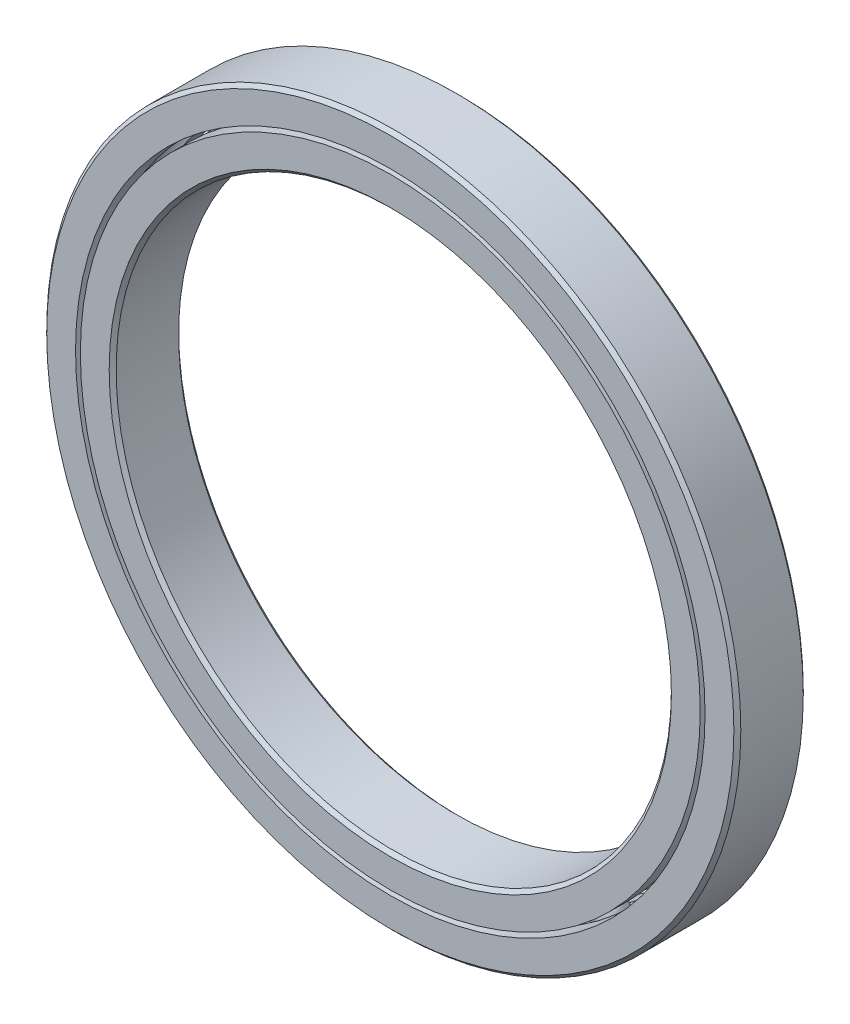
from build123d import *

# Parameters (mm, degrees)
CIRPATTERN1_COUNT = 10


with BuildPart() as part:
    # Sketch1 → Revolve1 (revolve)
    with BuildSketch(Plane(origin=(0, 0, 0), x_dir=(0, 0, -1), z_dir=(1, 0, 0))):
        with BuildLine():
            Line((2.8575, 31.75), (-2.8575, 31.75))
            Line((-2.8575, 31.75), (-3.175, 31.4325))
            Line((-3.175, 31.4325), (-3.175, 28.794807692))
            Line((-3.175, 28.794807692), (-1.411111111, 28.794807692))
            ThreePointArc((-1.411111111, 28.794807692), (0, 30.003128142), (1.411111111, 28.794807692))
            Line((1.411111111, 28.794807692), (3.175, 28.794807692))
            Line((3.175, 28.794807692), (3.175, 31.4325))
            Line((3.175, 31.4325), (2.8575, 31.75))
        make_face()
    revolve(axis=Axis((0, 0, 3.175), (0, 0, -1)))


with BuildPart() as body_2:
    # Sketch3 → Revolve3 (revolve)
    with BuildSketch(Plane(origin=(0, 0, 0), x_dir=(0, 0, -1), z_dir=(1, 0, 0))):
        with BuildLine():
            Line((-3.175, 28.355192308), (-1.411111111, 28.355192308))
            ThreePointArc((-1.411111111, 28.355192308), (0, 27.146871858), (1.411111111, 28.355192308))
            Line((1.411111111, 28.355192308), (3.175, 28.355192308))
            Line((3.175, 28.355192308), (3.175, 25.7175))
            Line((3.175, 25.7175), (2.8575, 25.4))
            Line((2.8575, 25.4), (-2.8575, 25.4))
            Line((-2.8575, 25.4), (-3.175, 25.7175))
            Line((-3.175, 25.7175), (-3.175, 28.355192308))
        make_face()
    revolve(axis=Axis((0, 0, 3.175), (0, 0, -1)))


with BuildPart() as body_3:
    # Sketch4 → Revolve4 (revolve)
    with BuildSketch(Plane(origin=(0, 0, 0), x_dir=(0, 0, -1), z_dir=(1, 0, 0))):
        with BuildLine():
            Line((-1.428128142, 28.575), (1.428128142, 28.575))
            ThreePointArc((1.428128142, 28.575), (0, 30.003128142), (-1.428128142, 28.575))
        make_face()
    revolve(axis=Axis((0, 28.575, 1.428128142), (0, 0, -1)))


with BuildPart() as cirpattern1_1:
    # CirPattern1: pattern copy
    add(body_3.part.rotate(Axis((0, 0, -3.175), (0, 0, 1)), 1 * 360 / CIRPATTERN1_COUNT))


with BuildPart() as cirpattern1_2:
    # CirPattern1: pattern copy
    add(body_3.part.rotate(Axis((0, 0, -3.175), (0, 0, 1)), 2 * 360 / CIRPATTERN1_COUNT))


with BuildPart() as cirpattern1_3:
    # CirPattern1: pattern copy
    add(body_3.part.rotate(Axis((0, 0, -3.175), (0, 0, 1)), 3 * 360 / CIRPATTERN1_COUNT))


with BuildPart() as cirpattern1_4:
    # CirPattern1: pattern copy
    add(body_3.part.rotate(Axis((0, 0, -3.175), (0, 0, 1)), 4 * 360 / CIRPATTERN1_COUNT))


with BuildPart() as cirpattern1_5:
    # CirPattern1: pattern copy
    add(body_3.part.rotate(Axis((0, 0, -3.175), (0, 0, 1)), 5 * 360 / CIRPATTERN1_COUNT))


with BuildPart() as cirpattern1_6:
    # CirPattern1: pattern copy
    add(body_3.part.rotate(Axis((0, 0, -3.175), (0, 0, 1)), 6 * 360 / CIRPATTERN1_COUNT))


with BuildPart() as cirpattern1_7:
    # CirPattern1: pattern copy
    add(body_3.part.rotate(Axis((0, 0, -3.175), (0, 0, 1)), 7 * 360 / CIRPATTERN1_COUNT))


with BuildPart() as cirpattern1_8:
    # CirPattern1: pattern copy
    add(body_3.part.rotate(Axis((0, 0, -3.175), (0, 0, 1)), 8 * 360 / CIRPATTERN1_COUNT))


with BuildPart() as cirpattern1_9:
    # CirPattern1: pattern copy
    add(body_3.part.rotate(Axis((0, 0, -3.175), (0, 0, 1)), 9 * 360 / CIRPATTERN1_COUNT))


solid = Compound([part.part, body_2.part, body_3.part, cirpattern1_1.part, cirpattern1_2.part, cirpattern1_3.part, cirpattern1_4.part, cirpattern1_5.part, cirpattern1_6.part, cirpattern1_7.part, cirpattern1_8.part, cirpattern1_9.part])
